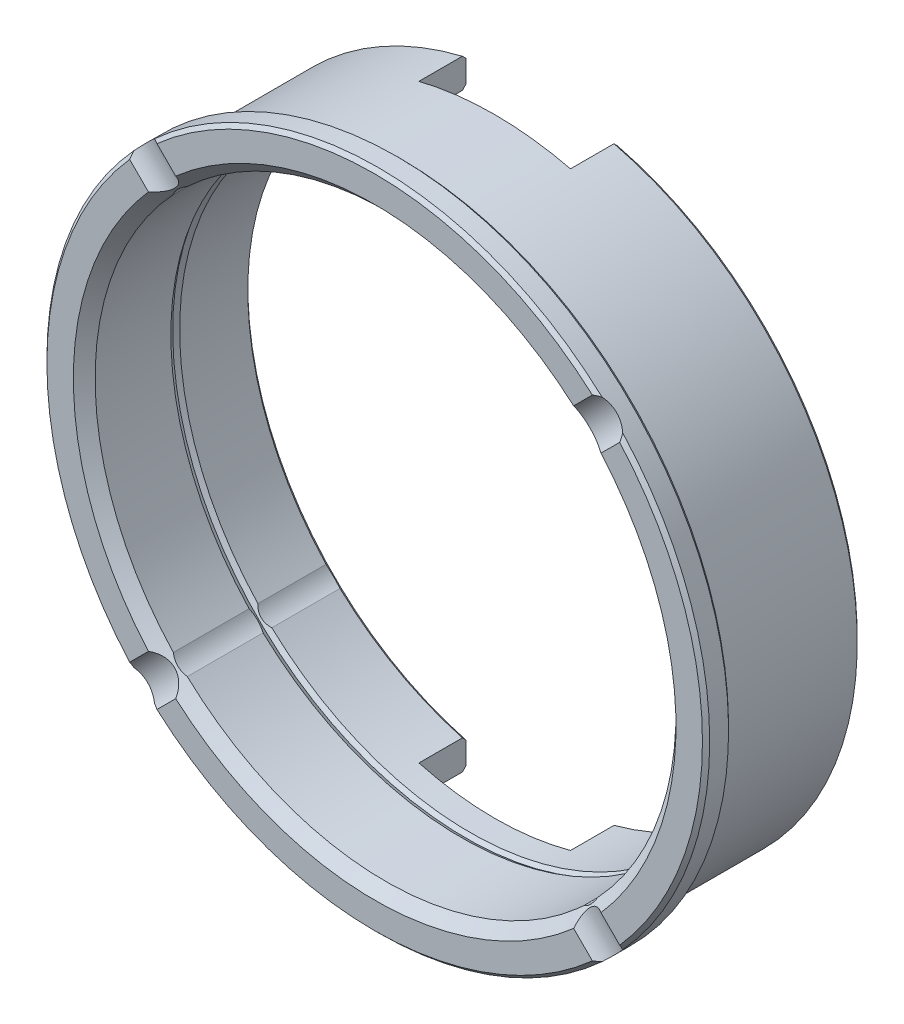
from build123d import *

# Parameters (mm, degrees)
SKETCH33_MESH_154_R                  = 4.25
CUT_EXTRUDE1_DEPTH                   = 69.616925755
SKETCH34_MESH_158_R                  = 3.9
EXTRUDE21_CUT_159_DEPTH              = 22.5
CIRPATTERN1_COUNT                    = 4
CUT_EXTRUDE11_REACH                  = 69.103
CUT_EXTRUDE11_END_RADIUS             = 44
SKETCH35_MESH_161_W                  = 20.9
SKETCH35_MESH_161_H                  = 6.5
CUT_EXTRUDE11_DIRECTION_2_REACH      = 69.103
CUT_EXTRUDE11_DIRECTION_2_END_RADIUS = 44


with BuildPart() as part:
    # Sketch32 (Mesh)_152 → Revolve1 (revolve)
    with BuildSketch(Plane(origin=(0, 0, 0), x_dir=(0, 0, -1), z_dir=(1, 0, 0))):
        Polygon((-16.55, -40.05), (-6.106217783, -40.05), (-5.5, -40.4), (-4.893782217, -40.05), (4.5, -40.05), (5, -40.55), (5, -43.5), (4.5, -44), (-14.45, -44), (-14.45, -45.2), (-14.95, -45.7), (-17.55, -45.7), (-18.05, -45.2), (-18.05, -41.55), align=None)
    revolve(axis=Axis((0, 0, 0), (0, 0, 1)))

    # Sketch33 (Mesh)_154 → Cut-Extrude1 (cut, through all)
    with BuildSketch(Plane.XY.offset(18.05)):
        with Locations((-25.455844123, 25.455844123)):
            Circle(SKETCH33_MESH_154_R)
    cut_extrude1 = extrude(amount=-CUT_EXTRUDE1_DEPTH, mode=Mode.SUBTRACT)

    # Sketch34 (Mesh)_158 → Extrude21 (Cut)_159 (cut, symmetric)
    with BuildSketch(Plane(origin=(-28.319626587, 28.319626587, 0), x_dir=(-0.7071067811865464, -0.7071067811865488, 0), z_dir=(0.7071067811865488, -0.7071067811865464, 0))):
        with Locations((0, -20.9)):
            Circle(SKETCH34_MESH_158_R)
    extrude21_cut_159 = extrude(amount=EXTRUDE21_CUT_159_DEPTH, both=True, mode=Mode.SUBTRACT)

    # CirPattern1: Cut-Extrude1, Extrude21 (Cut)_159 ×4 about axis
    cirpattern1_axis = Axis((0, 0, 0), (0, 0, -1))
    add([cut_extrude1.rotate(cirpattern1_axis, i * 360 / CIRPATTERN1_COUNT) for i in range(1, CIRPATTERN1_COUNT)], mode=Mode.SUBTRACT)
    add([extrude21_cut_159.rotate(cirpattern1_axis, i * 360 / CIRPATTERN1_COUNT) for i in range(1, CIRPATTERN1_COUNT)], mode=Mode.SUBTRACT)

    # Cut-Extrude11: up to this cylinder (the profile starts inside it)
    cut_extrude11_end = Plane(origin=(0, 0, -1.75), z_dir=(0, 0, -1)) * Cylinder(CUT_EXTRUDE11_END_RADIUS, 227.206, mode=Mode.PRIVATE)
    # Sketch35 (Mesh)_161 → Cut-Extrude11 (cut, up to the surface)
    with BuildSketch(Plane(origin=(0, 0, 0), x_dir=(1, 0, 0), z_dir=(0, 1, 0)), mode=Mode.PRIVATE) as cut_extrude11_sk1:
        with Locations((0, 1.75)):
            Rectangle(SKETCH35_MESH_161_W, SKETCH35_MESH_161_H)
    cut_extrude11_tool1 = extrude(cut_extrude11_sk1.sketch, amount=CUT_EXTRUDE11_REACH, mode=Mode.PRIVATE) & cut_extrude11_end
    add(cut_extrude11_tool1.solids().sort_by_distance((0, 0, -1.75))[0], mode=Mode.SUBTRACT)

    # Cut-Extrude11 direction 2: up to this cylinder (the profile starts inside it)
    cut_extrude11_direction_2_end = Plane(origin=(0, 0, -1.75), z_dir=(0, 0, -1)) * Cylinder(CUT_EXTRUDE11_DIRECTION_2_END_RADIUS, 227.206, mode=Mode.PRIVATE)
    # Sketch35 (Mesh)_161 → Cut-Extrude11 direction 2 (cut, up to the surface)
    with BuildSketch(Plane(origin=(0, 0, 0), x_dir=(1, 0, 0), z_dir=(0, 1, 0)), mode=Mode.PRIVATE) as cut_extrude11_direction_2_sk1:
        with Locations((0, 1.75)):
            Rectangle(SKETCH35_MESH_161_W, SKETCH35_MESH_161_H)
    cut_extrude11_direction_2_tool1 = extrude(cut_extrude11_direction_2_sk1.sketch, amount=-CUT_EXTRUDE11_DIRECTION_2_REACH, mode=Mode.PRIVATE) & cut_extrude11_direction_2_end
    add(cut_extrude11_direction_2_tool1.solids().sort_by_distance((0, 0, -1.75))[0], mode=Mode.SUBTRACT)


solid = part.part
